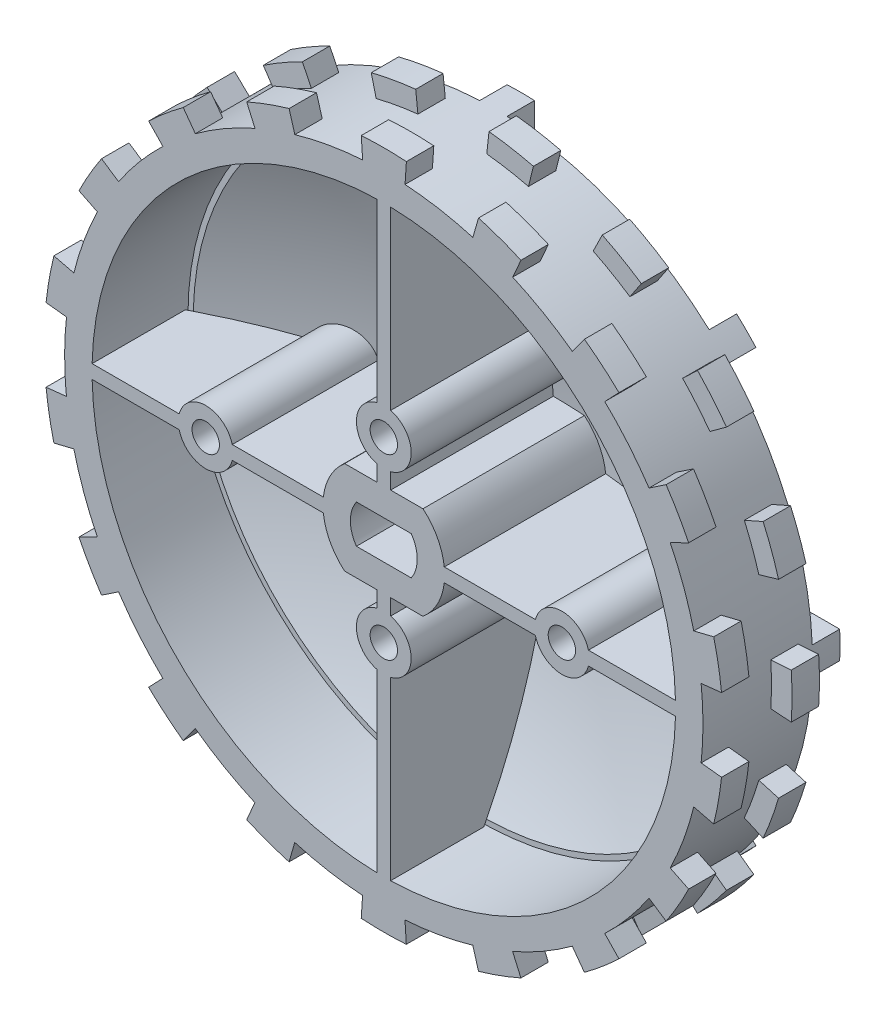
from build123d import *
from build123d.topology import SkipClean

# Parameters (mm, degrees)
SKETCH1_R                 = 23.3
BOSS_EXTRUDE3_DEPTH       = 7
CUT_EXTRUDE7_DEPTH        = 12
CUT_EXTRUDE9_DEPTH        = 11
CUT_EXTRUDE11_DEPTH       = 17
SHAFT_CUTOUT_DEPTH        = 14
BOSS_EXTRUDE5_DEPTH       = 2
BOSS_EXTRUDE7_START       = 5
BOSS_EXTRUDE7_DEPTH       = 2
CIRPATTERN2_COUNT         = 18
BOSS_EXTRUDE8_START       = 1
SKETCH10_R                = 23.3
BOSS_EXTRUDE8_DEPTH       = 1
DOME1_FACE_RADIUS         = 23.3
DOME1_HEIGHT              = 6
SKETCH1_27_R              = 21.3
SKETCH1_27_R_2            = 5.441311123
CUT_EXTRUDE14_DEPTH       = 7
BOSS_EXTRUDE9_START       = -2.3e-08
BOSS_EXTRUDE9_DEPTH       = 2.000000023
CUT_EXTRUDE16_REACH       = 39.763
CUT_EXTRUDE16_END_RADIUS  = 46.240833333
SKETCH13_R                = 5.441311123
SKETCH13_R_2              = 4.441311123
BOSS_EXTRUDE10_REACH      = 39.763
BOSS_EXTRUDE10_END_RADIUS = 46.240833333
SKETCH14_R                = 1
CUT_EXTRUDE17_START       = -12
CUT_EXTRUDE17_DEPTH       = 5


with BuildPart() as part:
    # Sketch1 → Boss-Extrude3 (new body)
    with BuildSketch(Plane.XY):
        Circle(SKETCH1_R)
    extrude(amount=BOSS_EXTRUDE3_DEPTH)

    # Sketch1<18> → Cut-Extrude7 (cut)
    with BuildSketch(Plane.XY):
        with BuildLine():
            Line((-1.5, 21.247117452), (-1.5, 5.23047481))
            ThreePointArc((-1.5, 5.23047481), (-4.712313663, 2.720655562), (-5.279724059, -1.316199299))
            Line((-5.279724059, -1.316199299), (-19.15054347, -9.32452062))
            ThreePointArc((-19.15054347, -9.32452062), (-18.446341101, 10.65), (-1.5, 21.247117452))
        make_face()
    extrude(amount=CUT_EXTRUDE7_DEPTH, mode=Mode.SUBTRACT)

    # Sketch1<19> → Cut-Extrude9 (cut)
    with BuildSketch(Plane.XY):
        with BuildLine():
            Line((1.5, 5.23047481), (1.5, 21.247117452))
            ThreePointArc((1.5, 21.247117452), (18.446341101, 10.65), (19.15054347, -9.32452062))
            Line((19.15054347, -9.32452062), (5.279724059, -1.316199299))
            ThreePointArc((5.279724059, -1.316199299), (4.712313663, 2.720655562), (1.5, 5.23047481))
        make_face()
    extrude(amount=CUT_EXTRUDE9_DEPTH, mode=Mode.SUBTRACT)

    # Sketch1<22> → Cut-Extrude11 (cut)
    with BuildSketch(Plane.XY):
        with BuildLine():
            ThreePointArc((17.65054347, -11.922596831), (0, -21.3), (-17.65054347, -11.922596831))
            Line((-17.65054347, -11.922596831), (-3.779724059, -3.914275511))
            ThreePointArc((-3.779724059, -3.914275511), (0, -5.441311123), (3.779724059, -3.914275511))
            Line((3.779724059, -3.914275511), (17.65054347, -11.922596831))
        make_face()
    extrude(amount=CUT_EXTRUDE11_DEPTH, mode=Mode.SUBTRACT)

    # Sketch1<23> → Shaft Cutout (cut)
    with BuildSketch(Plane.XY):
        with BuildLine():
            Line((-2, -1.4), (2, -1.4))
            ThreePointArc((2, -1.4), (2.441311123, 0), (2, 1.4))
            Line((2, 1.4), (-2, 1.4))
            ThreePointArc((-2, 1.4), (-2.441311123, 0), (-2, -1.4))
        make_face()
    extrude(amount=SHAFT_CUTOUT_DEPTH, mode=Mode.SUBTRACT)

    # Sketch9 → Boss-Extrude5 (add)
    with BuildSketch(Plane.XY):
        with BuildLine():
            ThreePointArc((2.515384521, 23.163826124), (4.048004942, 22.945667477), (5.562755963, 22.626218113))
            Line((5.562755963, 22.626218113), (5.920873299, 24.082841597))
            ThreePointArc((5.920873299, 24.082841597), (4.308606119, 24.422856371), (2.677319147, 24.655059566))
            Line((2.677319147, 24.655059566), (2.515384521, 23.163826124))
        make_face()
    boss_extrude5 = extrude(amount=BOSS_EXTRUDE5_DEPTH)

    # Sketch9<4> → Boss-Extrude7 (add)
    with BuildSketch(Plane.XY.offset(BOSS_EXTRUDE7_START)):
        with BuildLine():
            ThreePointArc((-1.545186016, 23.248707495), (0.002033309, 23.299999911), (1.549243657, 23.248437455))
            Line((1.549243657, 23.248437455), (1.648980373, 24.745117978))
            ThreePointArc((1.648980373, 24.745117978), (0.002164208, 24.799999906), (-1.64466151, 24.745405402))
            Line((-1.64466151, 24.745405402), (-1.545186016, 23.248707495))
        make_face()
    boss_extrude7 = extrude(amount=BOSS_EXTRUDE7_DEPTH)

    # CirPattern2: Boss-Extrude5, Boss-Extrude7 ×18 about axis
    cirpattern2_axis = Axis((0, 0, 0), (0, 0, 1))
    add([boss_extrude5.rotate(cirpattern2_axis, i * 360 / CIRPATTERN2_COUNT) for i in range(1, CIRPATTERN2_COUNT)])
    add([boss_extrude7.rotate(cirpattern2_axis, i * 360 / CIRPATTERN2_COUNT) for i in range(1, CIRPATTERN2_COUNT)])

    # Sketch10 → Boss-Extrude8 (add)
    with SkipClean():  # the faces are left unmerged after this step: merging them gives an invalid solid
        with BuildSketch(Plane(origin=(0, 0, 0), x_dir=(-1, 0, 0), z_dir=(0, 0, -1)).offset(BOSS_EXTRUDE8_START)):
            Circle(SKETCH10_R)
        extrude(amount=-BOSS_EXTRUDE8_DEPTH)

    # Dome1: a dome of height H over a round flat face of radius A is a cap of a sphere of radius (A * A + H * H) / (2 * H)
    dome1_r = (DOME1_FACE_RADIUS * DOME1_FACE_RADIUS + DOME1_HEIGHT * DOME1_HEIGHT) / (2 * DOME1_HEIGHT)
    dome1_base = Plane((0, 0, -1), z_dir=(0, 0, -1))
    with Locations(dome1_base.offset(DOME1_HEIGHT - dome1_r)):
        dome1_ball = Sphere(dome1_r, mode=Mode.PRIVATE)
    add(split(dome1_ball, bisect_by=dome1_base, keep=Keep.TOP, mode=Mode.PRIVATE))

    # Sketch1<27> → Cut-Extrude14 (cut)
    with SkipClean():  # the faces are left unmerged after this step: merging them gives an invalid solid
        with BuildSketch(Plane.XY):
            with Locations(Location((0, 0, 0), (0, 0, 180))):
                Circle(SKETCH1_27_R)
            with Locations(Location((0, 0, 0), (0, 0, 180))):
                Circle(SKETCH1_27_R_2, mode=Mode.SUBTRACT)
        extrude(amount=CUT_EXTRUDE14_DEPTH, mode=Mode.SUBTRACT)

    # Boss-Extrude9: read off the stored shape, not the designer's step
    # Boss-Extrude9 outline → Boss-Extrude9 (add)
    with SkipClean():  # the faces are left unmerged after this step: merging them gives an invalid solid
        with BuildSketch(Plane(origin=(0, 0, -1), x_dir=(-1, 0, 0), z_dir=(0, 0, -1)).offset(BOSS_EXTRUDE9_START)):
            with BuildLine():
                ThreePointArc((17.1674748, 15.753342788), (16.475588002, 16.475588002), (15.753342788, 17.1674748))
                Line((15.753342788, 17.1674748), (14.361861285, 15.775993297))
                ThreePointArc((14.361861285, 15.775993297), (14.346674031, 14.361861285), (15.760806043, 14.346674031))
                Line((15.760806043, 14.346674031), (17.1674748, 15.753342788))
            make_face()
            with BuildLine():
                Line((0.999942335, 21.289203325), (0.999942335, 23.278533359))
                ThreePointArc((0.999942335, 23.278533359), (0, 23.3), (-0.999942335, 23.278533359))
                Line((-0.999942335, 23.278533359), (-0.999942335, 21.310681345))
                Line((-0.999942335, 21.310681345), (-1, 21.299942335))
                ThreePointArc((-1, 21.299942335), (-0.005369582, 20.299956751), (0.999942335, 21.289203325))
            make_face()
            with BuildLine():
                ThreePointArc((23.3, 0), (23.294632721, 0.500086365), (23.278533359, 0.999942335))
                Line((23.278533359, 0.999942335), (21.310681345, 0.999942335))
                ThreePointArc((21.310681345, 0.999942335), (20.3, 0.01073901), (21.289203325, -0.999942335))
                Line((21.289203325, -0.999942335), (23.278533359, -0.999942335))
                ThreePointArc((23.278533359, -0.999942335), (23.294632721, -0.500086365), (23.3, 0))
            make_face()
            with BuildLine():
                Line((1, 19.207463827), (0.999942335, 21.289203325))
                ThreePointArc((0.999942335, 21.289203325), (-0.005369582, 20.299956751), (-1, 21.299942335))
                Line((-1, 21.299942335), (-1, 19.207463827))
                Line((-1, 19.207463827), (-1, 1))
                ThreePointArc((-1, 1), (0, 0), (1, 1))
                Line((1, 1), (1, 19.207463827))
            make_face()
            with BuildLine():
                Line((-14.346674031, 15.760806043), (-15.753342788, 17.1674748))
                ThreePointArc((-15.753342788, 17.1674748), (-16.475588002, 16.475588002), (-17.1674748, 15.753342788))
                Line((-17.1674748, 15.753342788), (-15.775993297, 14.361861285))
                ThreePointArc((-15.775993297, 14.361861285), (-14.361861285, 14.346674031), (-14.346674031, 15.760806043))
            make_face()
            with BuildLine():
                ThreePointArc((15.753342788, -17.1674748), (16.475588002, -16.475588002), (17.1674748, -15.753342788))
                Line((17.1674748, -15.753342788), (15.775993297, -14.361861285))
                ThreePointArc((15.775993297, -14.361861285), (14.361861285, -14.346674031), (14.346674031, -15.760806043))
                Line((14.346674031, -15.760806043), (15.753342788, -17.1674748))
            make_face()
            with BuildLine():
                Line((-21.289203325, 0.999942335), (-23.278533359, 0.999942335))
                ThreePointArc((-23.278533359, 0.999942335), (-23.3, 0), (-23.278533359, -0.999942335))
                Line((-23.278533359, -0.999942335), (-21.310681345, -0.999942335))
                ThreePointArc((-21.310681345, -0.999942335), (-20.3, -0.01073901), (-21.289203325, 0.999942335))
            make_face()
            with BuildLine():
                ThreePointArc((-0.999942335, -23.278533359), (0, -23.3), (0.999942335, -23.278533359))
                Line((0.999942335, -23.278533359), (0.999942335, -21.310681345))
                ThreePointArc((0.999942335, -21.310681345), (0.01073901, -20.3), (-0.999942335, -21.289203325))
                Line((-0.999942335, -21.289203325), (-0.999942335, -23.278533359))
            make_face()
            with BuildLine():
                Line((-15.760806043, -14.346674031), (-17.1674748, -15.753342788))
                ThreePointArc((-17.1674748, -15.753342788), (-16.475588002, -16.475588002), (-15.753342788, -17.1674748))
                Line((-15.753342788, -17.1674748), (-14.361861285, -15.775993297))
                ThreePointArc((-14.361861285, -15.775993297), (-14.346674031, -14.361861285), (-15.760806043, -14.346674031))
            make_face()
        extrude(amount=BOSS_EXTRUDE9_DEPTH)

    # Cut-Extrude15: read off the stored shape, not the designer's step
    # Cut-Extrude15 outline → Cut-Extrude15 (revolve, cut)
    with SkipClean():  # the faces are left unmerged after this step: merging them gives an invalid solid
        with BuildSketch(Plane.XZ):
            with BuildLine():
                Line((5.441311123, 0), (5.441311077, -4.678735492))
                ThreePointArc((5.441311077, -4.678735492), (13.383845612, -3.02074531), (20.914309337, 2.1e-08))
                Line((20.914309337, 2.1e-08), (5.441311123, 0))
            make_face()
        revolve(axis=Axis((0, 0, 0), (0, 0, 1)), mode=Mode.SUBTRACT)

    # Cut-Extrude16: up to this sphere (the profile starts inside it)
    with SkipClean():  # the faces are left unmerged after this step: merging them gives an invalid solid
        cut_extrude16_end = Location((0, 0, 41.240833333)) * Sphere(CUT_EXTRUDE16_END_RADIUS, mode=Mode.PRIVATE)
        # Sketch13 → Cut-Extrude16 (cut, up to the surface)
        with BuildSketch(Plane.XY.offset(7), mode=Mode.PRIVATE) as cut_extrude16_sk1:
            Circle(SKETCH13_R)
            Circle(SKETCH13_R_2, mode=Mode.SUBTRACT)
        cut_extrude16_tool1 = extrude(cut_extrude16_sk1.sketch, amount=-CUT_EXTRUDE16_REACH, mode=Mode.PRIVATE) & cut_extrude16_end
        add(cut_extrude16_tool1.solids().sort_by_distance((-5.287408, 0, 7))[0], mode=Mode.SUBTRACT)
        # Sketch13 → Cut-Extrude16 (cut, up to the surface)
        with BuildSketch(Plane.XY.offset(7), mode=Mode.PRIVATE) as cut_extrude16_sk2:
            with BuildLine():
                ThreePointArc((2.857489194, 3.4), (0, 4.441311123), (-2.857489194, 3.4))
                Line((-2.857489194, 3.4), (2.857489194, 3.4))
            make_face()
        cut_extrude16_tool2 = extrude(cut_extrude16_sk2.sketch, amount=-CUT_EXTRUDE16_REACH, mode=Mode.PRIVATE) & cut_extrude16_end
        add(cut_extrude16_tool2.solids().sort_by_distance((0, 3.821016, 7))[0], mode=Mode.SUBTRACT)
        # Sketch13 → Cut-Extrude16 (cut, up to the surface)
        with BuildSketch(Plane.XY.offset(7), mode=Mode.PRIVATE) as cut_extrude16_sk3:
            with BuildLine():
                Line((2.857489194, -3.4), (-2.857489194, -3.4))
                ThreePointArc((-2.857489194, -3.4), (0, -4.441311123), (2.857489194, -3.4))
            make_face()
        cut_extrude16_tool3 = extrude(cut_extrude16_sk3.sketch, amount=-CUT_EXTRUDE16_REACH, mode=Mode.PRIVATE) & cut_extrude16_end
        add(cut_extrude16_tool3.solids().sort_by_distance((0, -3.821016, 7))[0], mode=Mode.SUBTRACT)

    # Boss-Extrude10: up to this sphere (the profile starts inside it)
    with SkipClean():  # the faces are left unmerged after this step: merging them gives an invalid solid
        boss_extrude10_end = Location((0, 0, 41.240833333)) * Sphere(BOSS_EXTRUDE10_END_RADIUS, mode=Mode.PRIVATE)
        # Sketch14 → Boss-Extrude10 (add, up to the surface)
        with BuildSketch(Plane.XY.offset(7), mode=Mode.PRIVATE) as boss_extrude10_sk1:
            with BuildLine():
                Line((11.063508327, 0.5), (4.413076534, 0.5))
                ThreePointArc((4.413076534, 0.5), (4.441311123, 0), (4.413076534, -0.5))
                Line((4.413076534, -0.5), (11.063508327, -0.5))
                ThreePointArc((11.063508327, -0.5), (13, -2), (14.936491673, -0.5))
                Line((14.936491673, -0.5), (21.294130647, -0.5))
                ThreePointArc((21.294130647, -0.5), (21.3, 0), (21.294130647, 0.5))
                Line((21.294130647, 0.5), (14.936491673, 0.5))
                ThreePointArc((14.936491673, 0.5), (13, 2), (11.063508327, 0.5))
            make_face()
            with Locations((13, 0)):
                Circle(SKETCH14_R, mode=Mode.SUBTRACT)
        boss_extrude10_tool1 = extrude(boss_extrude10_sk1.sketch, amount=-BOSS_EXTRUDE10_REACH, mode=Mode.PRIVATE) & boss_extrude10_end
        add(boss_extrude10_tool1.solids().sort_by_distance((7.738292, 0.326458, 7))[0])
        # Sketch14 → Boss-Extrude10 (add, up to the surface)
        with BuildSketch(Plane.XY.offset(7), mode=Mode.PRIVATE) as boss_extrude10_sk2:
            with BuildLine():
                Line((-11.063508327, -0.5), (-4.413076534, -0.5))
                ThreePointArc((-4.413076534, -0.5), (-4.441311123, 0), (-4.413076534, 0.5))
                Line((-4.413076534, 0.5), (-11.063508327, 0.5))
                ThreePointArc((-11.063508327, 0.5), (-13, 2), (-14.936491673, 0.5))
                Line((-14.936491673, 0.5), (-21.294130647, 0.5))
                ThreePointArc((-21.294130647, 0.5), (-21.3, 0), (-21.294130647, -0.5))
                Line((-21.294130647, -0.5), (-14.936491673, -0.5))
                ThreePointArc((-14.936491673, -0.5), (-13, -2), (-11.063508327, -0.5))
            make_face()
            with Locations((-13, 0)):
                Circle(SKETCH14_R, mode=Mode.SUBTRACT)
        boss_extrude10_tool2 = extrude(boss_extrude10_sk2.sketch, amount=-BOSS_EXTRUDE10_REACH, mode=Mode.PRIVATE) & boss_extrude10_end
        add(boss_extrude10_tool2.solids().sort_by_distance((-13, -1.826458, 7))[0])
        # Sketch14 → Boss-Extrude10 (add, up to the surface)
        with BuildSketch(Plane.XY.offset(7), mode=Mode.PRIVATE) as boss_extrude10_sk3:
            with BuildLine():
                Line((0.5, -3.4), (-0.5, -3.4))
                Line((-0.5, -3.4), (-0.5, -4.563508327))
                ThreePointArc((-0.5, -4.563508327), (-2, -6.5), (-0.5, -8.436491673))
                Line((-0.5, -8.436491673), (-0.5, -21.294130647))
                ThreePointArc((-0.5, -21.294130647), (0, -21.3), (0.5, -21.294130647))
                Line((0.5, -21.294130647), (0.5, -8.436491673))
                ThreePointArc((0.5, -8.436491673), (2, -6.5), (0.5, -4.563508327))
                Line((0.5, -4.563508327), (0.5, -3.4))
            make_face()
            with Locations((0, -6.5)):
                Circle(SKETCH14_R, mode=Mode.SUBTRACT)
        boss_extrude10_tool3 = extrude(boss_extrude10_sk3.sketch, amount=-BOSS_EXTRUDE10_REACH, mode=Mode.PRIVATE) & boss_extrude10_end
        add(boss_extrude10_tool3.solids().sort_by_distance((0, -10.980486, 7))[0])
        # Sketch14 → Boss-Extrude10 (add, up to the surface)
        with BuildSketch(Plane.XY.offset(7), mode=Mode.PRIVATE) as boss_extrude10_sk4:
            with BuildLine():
                Line((-0.5, 3.4), (0.5, 3.4))
                Line((0.5, 3.4), (0.5, 4.563508327))
                ThreePointArc((0.5, 4.563508327), (2, 6.5), (0.5, 8.436491673))
                Line((0.5, 8.436491673), (0.5, 21.294130647))
                ThreePointArc((0.5, 21.294130647), (0, 21.3), (-0.5, 21.294130647))
                Line((-0.5, 21.294130647), (-0.5, 8.436491673))
                ThreePointArc((-0.5, 8.436491673), (-2, 6.5), (-0.5, 4.563508327))
                Line((-0.5, 4.563508327), (-0.5, 3.4))
            make_face()
            with Locations((0, 6.5)):
                Circle(SKETCH14_R, mode=Mode.SUBTRACT)
        boss_extrude10_tool4 = extrude(boss_extrude10_sk4.sketch, amount=-BOSS_EXTRUDE10_REACH, mode=Mode.PRIVATE) & boss_extrude10_end
        add(boss_extrude10_tool4.solids().sort_by_distance((0, 10.980486, 7))[0])

    # Cut-Extrude17: read off the stored shape, not the designer's step
    # Cut-Extrude17 outline → Cut-Extrude17 (cut)
    with SkipClean():  # the faces are left unmerged after this step: merging them gives an invalid solid
        with BuildSketch(Plane.XY.offset(7).offset(CUT_EXTRUDE17_START)):
            with BuildLine():
                ThreePointArc((2, -1.4), (2.441311123, 0), (2, 1.4))
                Line((2, 1.4), (-2, 1.4))
                ThreePointArc((-2, 1.4), (-2.441311123, 0), (-2, -1.4))
                Line((-2, -1.4), (2, -1.4))
            make_face()
        extrude(amount=CUT_EXTRUDE17_DEPTH, mode=Mode.SUBTRACT)

    # Cut-Extrude17 2 outline → Cut-Extrude17 2 (revolve)
    with SkipClean():  # the faces are left unmerged after this step: merging them gives an invalid solid
        with BuildSketch(Plane.XZ):
            with BuildLine():
                ThreePointArc((2.441311169, -4.935509821), (1.221081407, -4.983874644), (0, -5))
                Line((0, -5), (2.441311169, -5))
                Line((2.441311169, -5), (2.441311169, -4.935509821))
            make_face()
        revolve(axis=Axis((0, 0, 0), (0, 0, 1)))


solid = part.part
